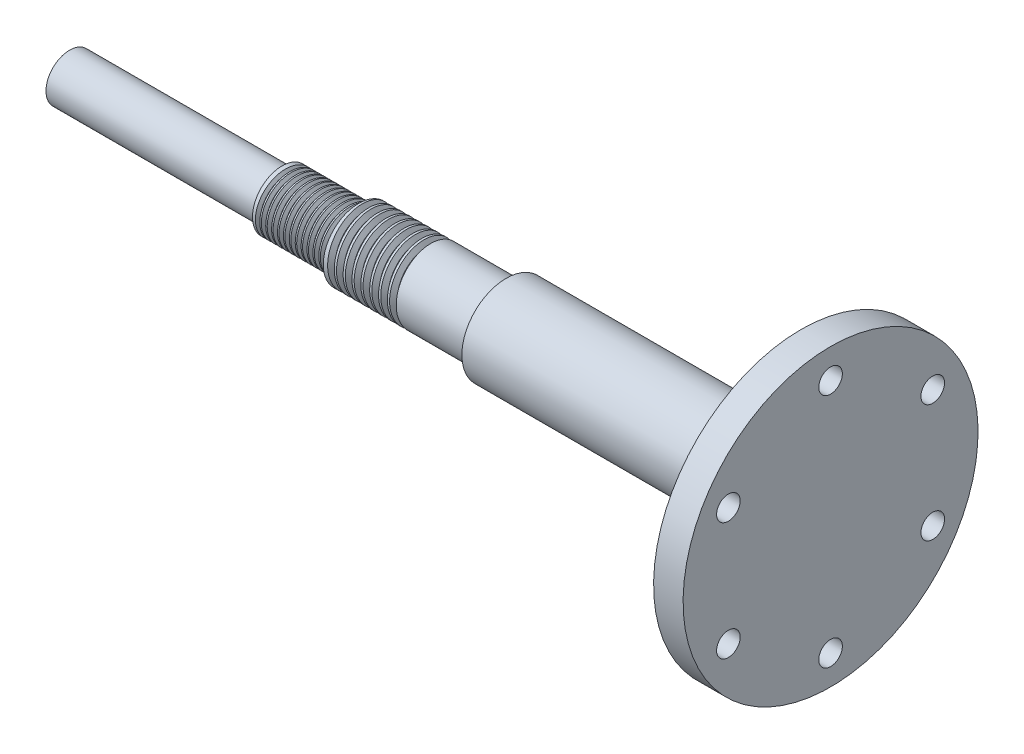
from build123d import *

# Parameters (mm, degrees)
SKETCH2_R           = 2
CUT_EXTRUDE1_DEPTH  = 10
SKETCH3_R           = 6
BOSS_EXTRUDE1_DEPTH = 25
SKETCH4_R           = 5
BOSS_EXTRUDE2_DEPTH = 13
SKETCH5_R           = 4
BOSS_EXTRUDE3_DEPTH = 36
THREAD1_PITCH       = 1.5
THREAD2_PITCH       = 1


with BuildPart() as part:
    # Sketch1 → Revolve1 (revolve)
    with BuildSketch(Plane.XY):
        Polygon((0, 11.578989394), (0, 19.078989394), (50, 19.078989394), (50, 36.578989394), (55, 36.578989394), (55, 11.578989394), align=None)
    revolve(axis=Axis((55, 11.578989394, 0), (-1, 0, 0)))

    # Sketch2 → Cut-Extrude1 (cut)
    with BuildSketch(Plane(origin=(55, 0, 0), x_dir=(0, 0, -1), z_dir=(1, 0, 0))):
        with Locations(Location((0, 31.578989394, 0), (0, 0, 90))):
            Circle(SKETCH2_R)
        with Locations(Location((17.320508076, 21.578989394, 0), (0, 0, 90))):
            Circle(SKETCH2_R)
        with Locations(Location((17.320508076, 1.578989394, 0), (0, 0, 90))):
            Circle(SKETCH2_R)
        with Locations(Location((0, -8.421010606, 0), (0, 0, 90))):
            Circle(SKETCH2_R)
        with Locations(Location((-17.320508076, 1.578989394, 0), (0, 0, 90))):
            Circle(SKETCH2_R)
        with Locations(Location((-17.320508076, 21.578989394, 0), (0, 0, 90))):
            Circle(SKETCH2_R)
    extrude(amount=-CUT_EXTRUDE1_DEPTH, mode=Mode.SUBTRACT)

    # Sketch3 → Boss-Extrude1 (add)
    with BuildSketch(Plane.ZY):
        with Locations(Location((0, 11.578989394, 0), (0, 0, 270))):
            Circle(SKETCH3_R)
    extrude(amount=BOSS_EXTRUDE1_DEPTH)

    # Sketch4 → Boss-Extrude2 (add)
    with BuildSketch(Plane.ZY.offset(25)):
        with Locations(Location((0, 11.578989394, 0), (0, 0, 90))):
            Circle(SKETCH4_R)
    extrude(amount=BOSS_EXTRUDE2_DEPTH)

    # Sketch5 → Boss-Extrude3 (add)
    with BuildSketch(Plane.ZY.offset(38)):
        with Locations(Location((0, 11.578989394, 0), (0, 0, 270))):
            Circle(SKETCH5_R)
    extrude(amount=BOSS_EXTRUDE3_DEPTH)

    # Thread1: arcs per turn and ends read off the stored shape
    # Thread1: the profile of Thread Profile1 profile screwed along a right-hand helix through 8 turns, 8 arcs to a turn; built about Z, then put on its axis
    thread1_z = Axis((0, 0, 0), (0, 0, 1))
    thread1_corners = [(6.0003, 0, -0.000173205), (5.188101188, 0, 0.468749998), (5.188101188, 0, 0.656249998), (6.0003, 0, 1.125173201)]
    with BuildLine(mode=Mode.PRIVATE) as thread1_profile:
        Line(thread1_corners[0], thread1_corners[1])
        Line(thread1_corners[1], thread1_corners[2])
        Line(thread1_corners[2], thread1_corners[3])
        Line(thread1_corners[3], thread1_corners[0])
    thread1_cap = Face(thread1_profile.wire())
    thread1_turn_angles = [0, 22.5, 45, 67.5, 90, 112.5, 135, 157.5, 180, 202.5, 225, 247.5, 270, 292.5, 315, 337.5, 360]
    thread1_turn_weights = [1, 0.9238795325112867, 1, 0.9238795325112867, 1, 0.9238795325112867, 1, 0.9238795325112867, 1, 0.9238795325112867, 1, 0.9238795325112867, 1, 0.9238795325112867, 1, 0.9238795325112867, 1]
    thread1_turn_rails = [Edge.make_bspline([Vector(p[0], p[1], 0).rotate(thread1_z, thread1_turn_angles[k]) / thread1_turn_weights[k] + Vector(0, 0, p[2] + THREAD1_PITCH * thread1_turn_angles[k] / 360) for k in range(17)], [0, 0, 0, 1, 1, 2, 2, 3, 3, 4, 4, 5, 5, 6, 6, 7, 7, 8, 8, 8], 2, thread1_turn_weights) for p in thread1_corners]
    thread1_turn_sides = [Face.make_surface_from_curves(thread1_turn_rails[p[0]], thread1_turn_rails[p[1]]) for p in [(0, 1), (1, 2), (2, 3), (3, 0)]]
    thread1 = Plane(origin=(-25, 11.578989394, 0), x_dir=(0, 0, -1), z_dir=(1, 0, 0)) * Solid(Shell([*[p.moved(Location((0, 0, THREAD1_PITCH * i))) for i in range(8) for p in thread1_turn_sides], thread1_cap, thread1_cap.rotate(thread1_z, 2880).moved(Location((0, 0, THREAD1_PITCH * 2880 / 360)))]))
    add(thread1, mode=Mode.SUBTRACT)

    # Thread2: arcs per turn and ends read off the stored shape
    # Thread2: the profile of Thread Profile2 profile screwed along a left-hand helix through 12 turns, 8 arcs to a turn; built about Z, then put on its axis
    thread2_z = Axis((0, 0, 0), (0, 0, 1))
    thread2_corners = [(5.0003, 0, -0.000173205), (4.458734125, 0, 0.312499999), (4.458734125, 0, 0.437499999), (5.0003, 0, 0.750173202)]
    with BuildLine(mode=Mode.PRIVATE) as thread2_profile:
        Line(thread2_corners[0], thread2_corners[1])
        Line(thread2_corners[1], thread2_corners[2])
        Line(thread2_corners[2], thread2_corners[3])
        Line(thread2_corners[3], thread2_corners[0])
    thread2_cap = Face(thread2_profile.wire())
    thread2_turn_angles = [0, -22.5, -45, -67.5, -90, -112.5, -135, -157.5, -180, -202.5, -225, -247.5, -270, -292.5, -315, -337.5, -360]
    thread2_turn_weights = [1, 0.9238795325112867, 1, 0.9238795325112867, 1, 0.9238795325112867, 1, 0.9238795325112867, 1, 0.9238795325112867, 1, 0.9238795325112867, 1, 0.9238795325112867, 1, 0.9238795325112867, 1]
    thread2_turn_rails = [Edge.make_bspline([Vector(p[0], p[1], 0).rotate(thread2_z, thread2_turn_angles[k]) / thread2_turn_weights[k] + Vector(0, 0, p[2] + -THREAD2_PITCH * thread2_turn_angles[k] / 360) for k in range(17)], [0, 0, 0, 1, 1, 2, 2, 3, 3, 4, 4, 5, 5, 6, 6, 7, 7, 8, 8, 8], 2, thread2_turn_weights) for p in thread2_corners]
    thread2_turn_sides = [Face.make_surface_from_curves(thread2_turn_rails[p[0]], thread2_turn_rails[p[1]]) for p in [(0, 1), (1, 2), (2, 3), (3, 0)]]
    thread2 = Plane(origin=(-38, 11.578989394, 0), x_dir=(0, 0, -1), z_dir=(1, 0, 0)) * Solid(Shell([*[p.moved(Location((0, 0, THREAD2_PITCH * i))) for i in range(12) for p in thread2_turn_sides], thread2_cap, thread2_cap.rotate(thread2_z, -4320).moved(Location((0, 0, -THREAD2_PITCH * -4320 / 360)))]))
    add(thread2, mode=Mode.SUBTRACT)


solid = part.part
